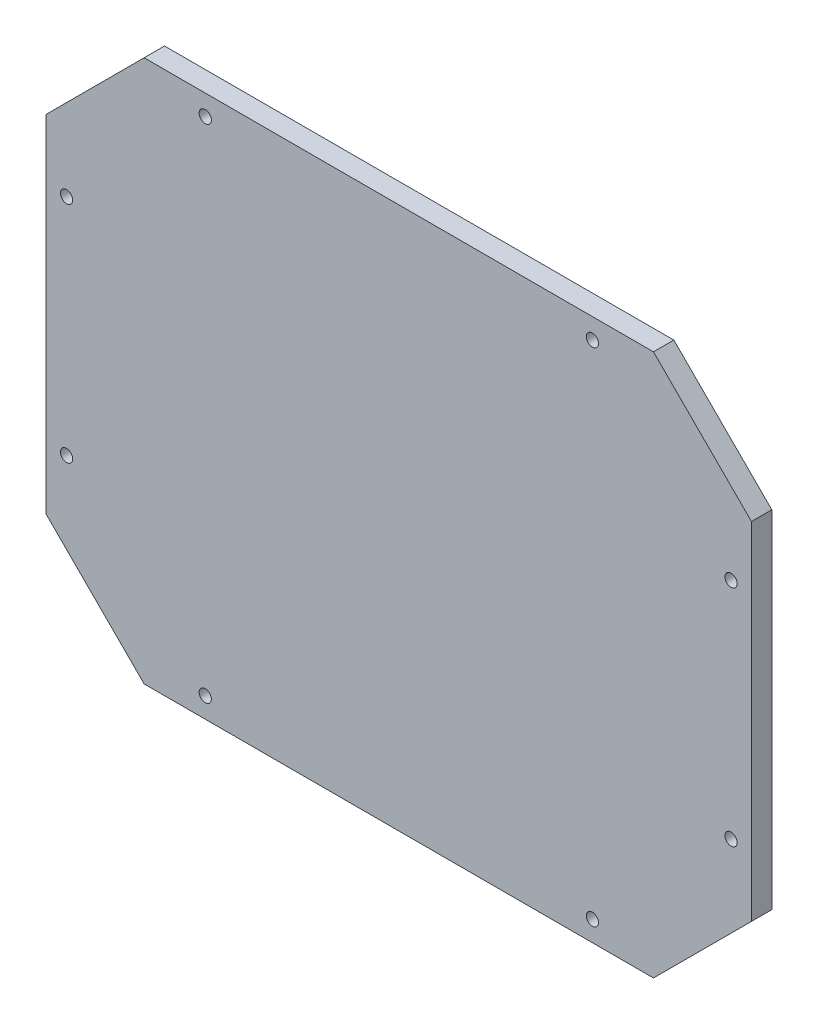
from build123d import *

# Parameters (mm, degrees)
SKETCH1_R             = 2.1
SKETCH1_R_2           = 1.5
BOSS_EXTRUDE1_DEPTH   = 5
DELETEFACE1_OUTLINE_R = 2.1
DELETEFACE1_DEPTH     = 5


# Read off the part's stored shape, not the designer's step: DeleteFace1
with BuildPart() as part:
    # Sketch1 → Boss-Extrude1 (new body)
    with BuildSketch(Plane.XY.offset(5)):
        Polygon((-24.04163056, 24.04163056), (0, 0), (125, 0), (149.04163056, 24.04163056), (149.04163056, 109.04163056), (125, 133.083261121), (0, 133.083261121), (-24.04163056, 109.04163056), align=None)
        with Locations((118.731419269, 101.776120312)):
            Circle(SKETCH1_R, mode=Mode.SUBTRACT)
        with Locations((78.347048523, 57.984145877)):
            Circle(SKETCH1_R, mode=Mode.SUBTRACT)
        with Locations((53.279835174, 85.131070757)):
            Circle(SKETCH1_R, mode=Mode.SUBTRACT)
        with Locations((46.652951477, 57.984145877)):
            Circle(SKETCH1_R, mode=Mode.SUBTRACT)
        with Locations((6.268580731, 31.307140809)):
            Circle(SKETCH1_R, mode=Mode.SUBTRACT)
        with Locations((6.268580731, 101.776120312)):
            Circle(SKETCH1_R, mode=Mode.SUBTRACT)
        with Locations((71.720164826, 47.952190364)):
            Circle(SKETCH1_R, mode=Mode.SUBTRACT)
        with Locations((78.347048523, 75.099115243)):
            Circle(SKETCH1_R, mode=Mode.SUBTRACT)
        with Locations((112.104535572, 111.808075826)):
            Circle(SKETCH1_R, mode=Mode.SUBTRACT)
        with Locations((118.731419269, 31.307140809)):
            Circle(SKETCH1_R, mode=Mode.SUBTRACT)
        with Locations((46.652951477, 75.099115243)):
            Circle(SKETCH1_R, mode=Mode.SUBTRACT)
        with Locations((53.279835174, 47.952190364)):
            Circle(SKETCH1_R, mode=Mode.SUBTRACT)
        with Locations((12.895464428, 21.275185295)):
            Circle(SKETCH1_R, mode=Mode.SUBTRACT)
        with Locations((12.895464428, 111.808075826)):
            Circle(SKETCH1_R, mode=Mode.SUBTRACT)
        with Locations((112.104535572, 21.275185295)):
            Circle(SKETCH1_R, mode=Mode.SUBTRACT)
        with Locations((71.720164826, 85.131070757)):
            Circle(SKETCH1_R, mode=Mode.SUBTRACT)
        with Locations((144.041630486, 94.041630337)):
            Circle(SKETCH1_R_2, mode=Mode.SUBTRACT)
        with Locations((-19.041630486, 39.041630784)):
            Circle(SKETCH1_R_2, mode=Mode.SUBTRACT)
        with Locations((144.041630486, 39.041630784)):
            Circle(SKETCH1_R_2, mode=Mode.SUBTRACT)
        with Locations((15.000000224, 5.000000075)):
            Circle(SKETCH1_R_2, mode=Mode.SUBTRACT)
        with Locations((109.999999776, 5.000000075)):
            Circle(SKETCH1_R_2, mode=Mode.SUBTRACT)
        with Locations((109.999999776, 128.083261046)):
            Circle(SKETCH1_R_2, mode=Mode.SUBTRACT)
        with Locations((15.000000224, 128.083261046)):
            Circle(SKETCH1_R_2, mode=Mode.SUBTRACT)
        with Locations((-19.041630486, 94.041630337)):
            Circle(SKETCH1_R_2, mode=Mode.SUBTRACT)
        Polygon((4.803542307, 37.516408095), (41.516606622, 61.768230885), (54.744873598, 41.742923077), (18.031809283, 17.491100287), align=None, mode=Mode.SUBTRACT)
        Polygon((18.031809283, 115.592160833), (54.744873598, 91.340338044), (41.516606622, 71.315030236), (4.803542307, 95.566853025), align=None, mode=Mode.SUBTRACT)
        Polygon((70.255126402, 41.742923077), (83.483393378, 61.768230885), (120.196457693, 37.516408095), (106.968190717, 17.491100287), align=None, mode=Mode.SUBTRACT)
        Polygon((83.483393378, 71.315030236), (70.255126402, 91.340338044), (106.968190717, 115.592160833), (120.196457693, 95.566853025), align=None, mode=Mode.SUBTRACT)
    extrude(amount=-BOSS_EXTRUDE1_DEPTH)

    # DeleteFace1 outline → DeleteFace1 (add)
    with BuildSketch(Plane.XY):
        Polygon((41.516606622, 61.768230885), (4.803542307, 37.516408095), (18.031809283, 17.491100287), (54.744873598, 41.742923077), align=None)
        Polygon((54.744873598, 91.340338044), (18.031809283, 115.592160833), (4.803542307, 95.566853025), (41.516606622, 71.315030236), align=None)
        Polygon((83.483393378, 61.768230885), (70.255126402, 41.742923077), (106.968190717, 17.491100287), (120.196457693, 37.516408095), align=None)
        Polygon((70.255126402, 91.340338044), (83.483393378, 71.315030236), (120.196457693, 95.566853025), (106.968190717, 115.592160833), align=None)
        with Locations((118.731419269, 101.776120312)):
            Circle(DELETEFACE1_OUTLINE_R)
        with Locations((78.347048523, 57.984145877)):
            Circle(DELETEFACE1_OUTLINE_R)
        with Locations((53.279835174, 85.131070757)):
            Circle(DELETEFACE1_OUTLINE_R)
        with Locations((46.652951477, 57.984145877)):
            Circle(DELETEFACE1_OUTLINE_R)
        with Locations((6.268580731, 31.307140809)):
            Circle(DELETEFACE1_OUTLINE_R)
        with Locations((6.268580731, 101.776120312)):
            Circle(DELETEFACE1_OUTLINE_R)
        with Locations((71.720164826, 47.952190364)):
            Circle(DELETEFACE1_OUTLINE_R)
        with Locations((78.347048523, 75.099115243)):
            Circle(DELETEFACE1_OUTLINE_R)
        with Locations((112.104535572, 111.808075826)):
            Circle(DELETEFACE1_OUTLINE_R)
        with Locations((118.731419269, 31.307140809)):
            Circle(DELETEFACE1_OUTLINE_R)
        with Locations((46.652951477, 75.099115243)):
            Circle(DELETEFACE1_OUTLINE_R)
        with Locations((53.279835174, 47.952190364)):
            Circle(DELETEFACE1_OUTLINE_R)
        with Locations((12.895464428, 21.275185295)):
            Circle(DELETEFACE1_OUTLINE_R)
        with Locations((12.895464428, 111.808075826)):
            Circle(DELETEFACE1_OUTLINE_R)
        with Locations((112.104535572, 21.275185295)):
            Circle(DELETEFACE1_OUTLINE_R)
        with Locations((71.720164826, 85.131070757)):
            Circle(DELETEFACE1_OUTLINE_R)
    extrude(amount=DELETEFACE1_DEPTH)


solid = part.part
